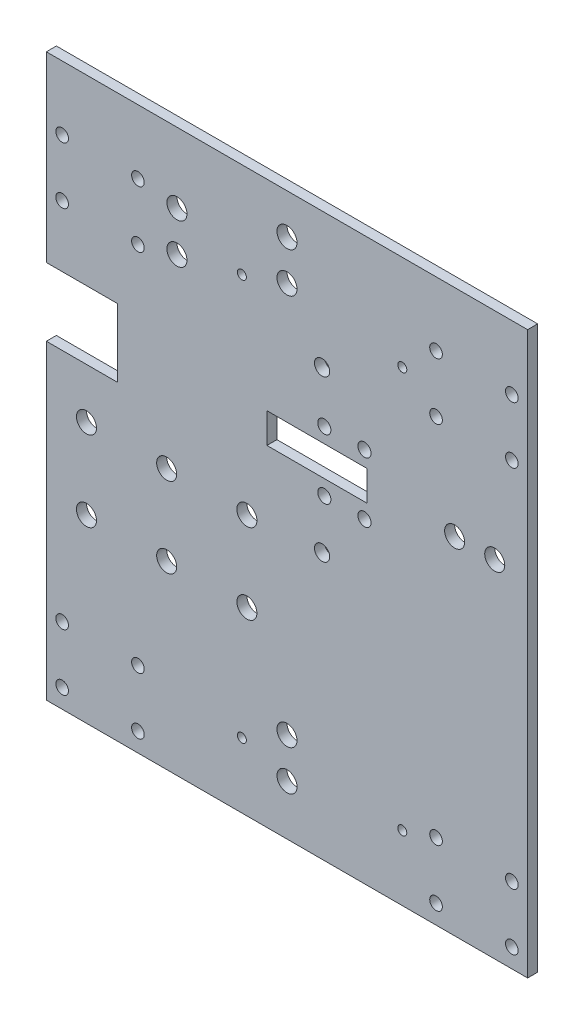
from build123d import *

# Parameters (mm, degrees)
SKETCH1_R           = 3.175
SKETCH1_R_2         = 2.0828
SKETCH1_R_3         = 2
SKETCH1_R_4         = 2.413
SKETCH1_R_5         = 1.4224
SKETCH1_W           = 31.75
SKETCH1_H           = 9.525
BOSS_EXTRUDE1_DEPTH = 3.175


with BuildPart() as part:
    # Sketch1 → Boss-Extrude1 (new body)
    with BuildSketch(Plane.XY):
        Polygon((0, 0), (152.4, 0), (152.4, 177.8), (0, 177.8), (0, 120.015), (22.518381447, 120.015), (22.518381447, 98.425), (0, 98.425), align=None)
        with Locations((38.1, 82.55)):
            Circle(SKETCH1_R, mode=Mode.SUBTRACT)
        with Locations((63.5, 82.55)):
            Circle(SKETCH1_R, mode=Mode.SUBTRACT)
        with Locations((38.1, 57.15)):
            Circle(SKETCH1_R, mode=Mode.SUBTRACT)
        with Locations((63.5, 57.15)):
            Circle(SKETCH1_R, mode=Mode.SUBTRACT)
        with Locations((88.0237, 100.0125)):
            Circle(SKETCH1_R_2, mode=Mode.SUBTRACT)
        with Locations((100.7237, 100.0125)):
            Circle(SKETCH1_R_2, mode=Mode.SUBTRACT)
        with Locations((88.0237, 119.0625)):
            Circle(SKETCH1_R_2, mode=Mode.SUBTRACT)
        with Locations((100.7237, 119.0625)):
            Circle(SKETCH1_R_2, mode=Mode.SUBTRACT)
        with Locations((129.286, 109.5375)):
            Circle(SKETCH1_R, mode=Mode.SUBTRACT)
        with Locations((123.4, 139.48)):
            Circle(SKETCH1_R_3, mode=Mode.SUBTRACT)
        with Locations((147.4, 139.48)):
            Circle(SKETCH1_R_3, mode=Mode.SUBTRACT)
        with Locations((123.4, 157.48)):
            Circle(SKETCH1_R_3, mode=Mode.SUBTRACT)
        with Locations((147.4, 157.48)):
            Circle(SKETCH1_R_3, mode=Mode.SUBTRACT)
        with Locations((5, 6)):
            Circle(SKETCH1_R_3, mode=Mode.SUBTRACT)
        with Locations((29, 6)):
            Circle(SKETCH1_R_3, mode=Mode.SUBTRACT)
        with Locations((5, 24)):
            Circle(SKETCH1_R_3, mode=Mode.SUBTRACT)
        with Locations((29, 24)):
            Circle(SKETCH1_R_3, mode=Mode.SUBTRACT)
        with Locations((5, 139.48)):
            Circle(SKETCH1_R_3, mode=Mode.SUBTRACT)
        with Locations((29, 139.48)):
            Circle(SKETCH1_R_3, mode=Mode.SUBTRACT)
        with Locations((5, 157.48)):
            Circle(SKETCH1_R_3, mode=Mode.SUBTRACT)
        with Locations((29, 157.48)):
            Circle(SKETCH1_R_3, mode=Mode.SUBTRACT)
        with Locations((123.4, 6)):
            Circle(SKETCH1_R_3, mode=Mode.SUBTRACT)
        with Locations((147.4, 6)):
            Circle(SKETCH1_R_3, mode=Mode.SUBTRACT)
        with Locations((123.4, 24)):
            Circle(SKETCH1_R_3, mode=Mode.SUBTRACT)
        with Locations((147.4, 24)):
            Circle(SKETCH1_R_3, mode=Mode.SUBTRACT)
        with Locations((41.35, 155.575)):
            Circle(SKETCH1_R, mode=Mode.SUBTRACT)
        with Locations((41.35, 142.875)):
            Circle(SKETCH1_R, mode=Mode.SUBTRACT)
        with Locations((12.7, 57.15)):
            Circle(SKETCH1_R, mode=Mode.SUBTRACT)
        with Locations((12.7, 82.55)):
            Circle(SKETCH1_R, mode=Mode.SUBTRACT)
        with Locations((141.986, 109.5375)):
            Circle(SKETCH1_R, mode=Mode.SUBTRACT)
        with Locations((87.3125, 84.1375)):
            Circle(SKETCH1_R_4, mode=Mode.SUBTRACT)
        with Locations((87.3125, 134.9375)):
            Circle(SKETCH1_R_4, mode=Mode.SUBTRACT)
        with Locations((61.9125, 147.6375)):
            Circle(SKETCH1_R_5, mode=Mode.SUBTRACT)
        with Locations((112.7125, 147.6375)):
            Circle(SKETCH1_R_5, mode=Mode.SUBTRACT)
        with Locations((112.7125, 20.6375)):
            Circle(SKETCH1_R_5, mode=Mode.SUBTRACT)
        with Locations((61.9125, 20.6375)):
            Circle(SKETCH1_R_5, mode=Mode.SUBTRACT)
        with Locations((76.2, 28.575)):
            Circle(SKETCH1_R, mode=Mode.SUBTRACT)
        with Locations((76.2, 15.875)):
            Circle(SKETCH1_R, mode=Mode.SUBTRACT)
        with Locations((76.2, 165.1)):
            Circle(SKETCH1_R, mode=Mode.SUBTRACT)
        with Locations((76.2, 152.4)):
            Circle(SKETCH1_R, mode=Mode.SUBTRACT)
        with Locations((85.725, 109.5375)):
            Rectangle(SKETCH1_W, SKETCH1_H, mode=Mode.SUBTRACT)
    extrude(amount=BOSS_EXTRUDE1_DEPTH)


solid = part.part
